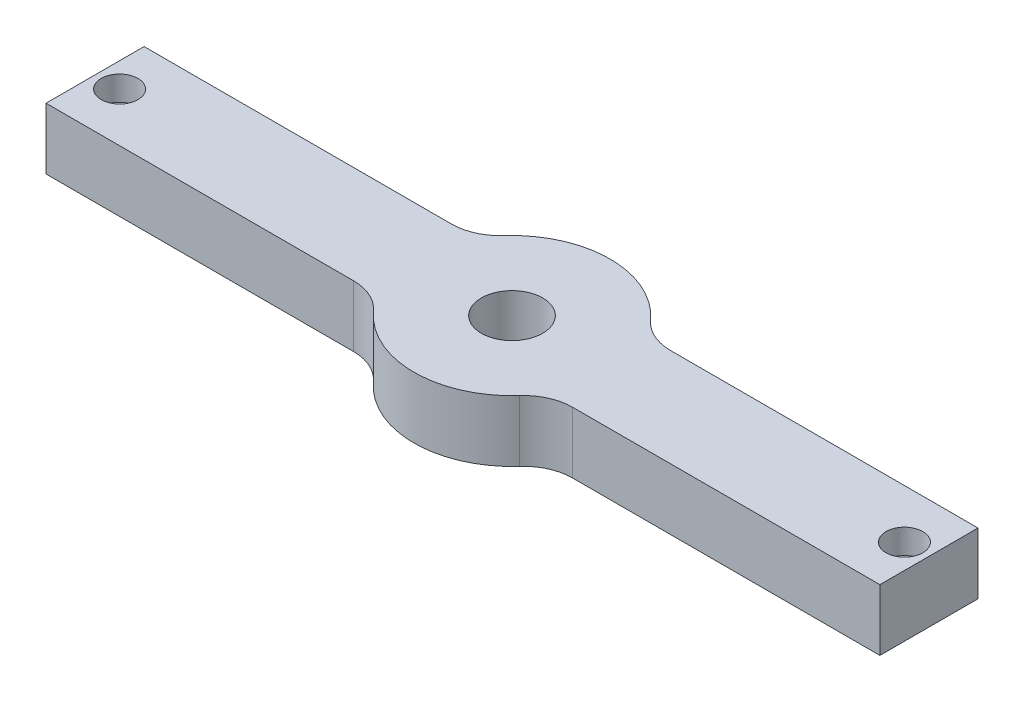
from build123d import *

# Parameters (mm, degrees)
SKETCH2_R           = 7.9375
BOSS_EXTRUDE1_DEPTH = 15.875
FILLET1_R           = 12.7
SKETCH3_R           = 22.225
CUT_EXTRUDE1_DEPTH  = 3.175
SKETCH4_R           = 4.7625
CUT_EXTRUDE2_DEPTH  = 6.35
SKETCH5_R           = 3.175
CUT_EXTRUDE3_DEPTH  = 115.871833471


with BuildPart() as part:
    # Sketch2 → Boss-Extrude1 (new body)
    with BuildSketch(Plane(origin=(0, 0, 0), x_dir=(1, 0, 0), z_dir=(0, 1, 0))):
        with BuildLine():
            Line((-107.95, 0), (-107.95, -25.4))
            Line((-107.95, -25.4), (-21.997045256, -25.4))
            ThreePointArc((-21.997045256, -25.4), (0, -38.1), (21.997045256, -25.4))
            Line((21.997045256, -25.4), (107.95, -25.4))
            Line((107.95, -25.4), (107.95, 0))
            Line((107.95, 0), (21.997045256, 0))
            ThreePointArc((21.997045256, 0), (0, 12.7), (-21.997045256, 0))
            Line((-21.997045256, 0), (-107.95, 0))
        make_face()
        with Locations((0, -12.7)):
            Circle(SKETCH2_R, mode=Mode.SUBTRACT)
    extrude(amount=BOSS_EXTRUDE1_DEPTH)

    # Fillet1
    fillet1_edges = [part.edges().sort_by_distance(p)[0] for p in [
        (21.997045256, 7.9375, 0),
        (21.997045256, 7.9375, 25.4),
        (-21.997045256, 7.9375, 25.4),
        (-21.997045256, 7.9375, 0),
    ]]
    fillet(fillet1_edges, radius=FILLET1_R)

    # Sketch3 → Cut-Extrude1 (cut)
    with BuildSketch(Plane.XZ):
        with Locations((0, 12.7)):
            Circle(SKETCH3_R)
    extrude(amount=-CUT_EXTRUDE1_DEPTH, mode=Mode.SUBTRACT)

    # Sketch4 → Cut-Extrude2 (cut)
    with BuildSketch(Plane(origin=(0, 15.875, 0), x_dir=(1, 0, 0), z_dir=(0, 1, 0))):
        with Locations((-101.6, -12.7)):
            Circle(SKETCH4_R)
        with Locations((101.6, -12.7)):
            Circle(SKETCH4_R)
    extrude(amount=-CUT_EXTRUDE2_DEPTH, mode=Mode.SUBTRACT)

    # Sketch5 → Cut-Extrude3 (cut, through all)
    with BuildSketch(Plane(origin=(0, 9.525, 0), x_dir=(1, 0, 0), z_dir=(0, 1, 0))):
        with Locations((-101.6, -12.7)):
            Circle(SKETCH5_R)
        with Locations((101.6, -12.7)):
            Circle(SKETCH5_R)
    extrude(amount=-CUT_EXTRUDE3_DEPTH, mode=Mode.SUBTRACT)


solid = part.part
